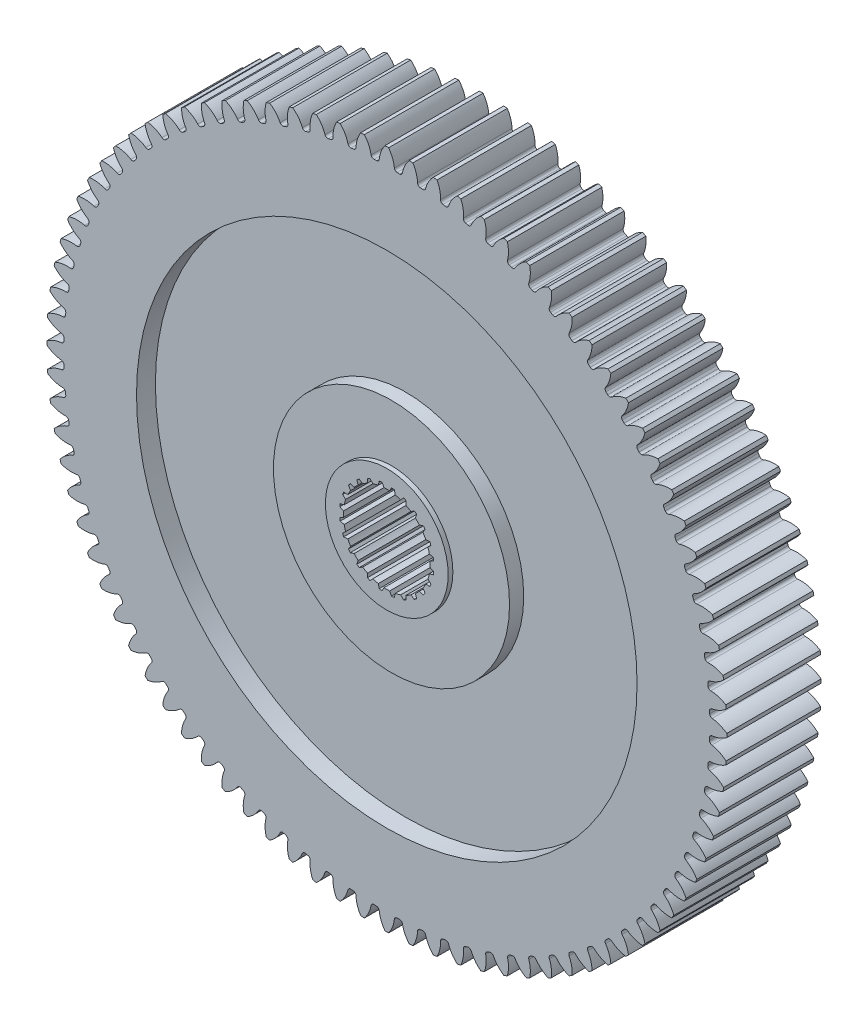
from build123d import *

# Parameters (mm, degrees)
ENL_V_MAT_EXTRU_1_DEPTH      = 52.15662225
R_P_TITION_CIRCULAIRE1_COUNT = 24
ENL_V_MAT_EXTRU_2_DEPTH      = 52.15662225
R_P_TITION_CIRCULAIRE2_COUNT = 88


with BuildPart() as part:
    # Esquisse1 → Révolution1 (revolve)
    with BuildSketch(Plane(origin=(0, 0, 0), x_dir=(0, 0, -1), z_dir=(1, 0, 0))):
        Polygon((-5, 4.6), (5, 4.6), (5, 6.5), (4.5, 6.5), (4.5, 12.5), (3, 12.5), (3, 26.5), (5, 26.5), (5, 36), (-5, 36), (-5, 26.5), (-3, 26.5), (-3, 12.5), (-4.5, 12.5), (-4.5, 6.5), (-5, 6.5), align=None)
    revolve(axis=Axis((0, 0, 15.512195122), (0, 0, -1)))

    # Esquisse2 → Enlèv. mat.-Extru.1 (cut, symmetric)
    with BuildSketch(Plane.XY):
        with BuildLine():
            Line((0.25, 4.493050189), (0.5, 4.974937186))
            ThreePointArc((0.5, 4.974937186), (0.652630961, 4.957224307), (0.804645579, 4.934829834))
            Line((0.804645579, 4.934829834), (0.921405503, 4.404657978))
            ThreePointArc((0.921405503, 4.404657978), (0.587367865, 4.461501876), (0.25, 4.493050189))
        make_face()
    enl_v_mat_extru_1 = extrude(amount=ENL_V_MAT_EXTRU_1_DEPTH, both=True, mode=Mode.SUBTRACT)

    # Répétition circulaire1: Enlèv. mat.-Extru.1 ×24 about axis
    r_p_tition_circulaire1_axis = Axis((0, 0, 0), (0, 0, 1))
    for i in range(1, R_P_TITION_CIRCULAIRE1_COUNT):
        add(enl_v_mat_extru_1.rotate(r_p_tition_circulaire1_axis, i * 360 / R_P_TITION_CIRCULAIRE1_COUNT), mode=Mode.SUBTRACT)

    # Esquisse3 → Enlèv. mat.-Extru.2 (cut, symmetric)
    with BuildSketch(Plane.XY):
        with BuildLine():
            ThreePointArc((1.350603123, 34.173321044), (1.220677817, 34.178208637), (1.090734869, 34.182602263))
            ThreePointArc((1.090734869, 34.182602263), (0.896560366, 34.262247349), (0.80209981, 34.449662077))
            ThreePointArc((0.80209981, 34.449662077), (0.601789765, 35.264614462), (0.196489878, 35.99946377))
            ThreePointArc((0.196489878, 35.99946377), (1.284924018, 35.977061724), (2.372183097, 35.92175869))
            ThreePointArc((2.372183097, 35.92175869), (1.915492317, 35.217695457), (1.657554603, 34.419109432))
            ThreePointArc((1.657554603, 34.419109432), (1.549964707, 34.238910954), (1.350603123, 34.173321044))
        make_face()
    enl_v_mat_extru_2 = extrude(amount=ENL_V_MAT_EXTRU_2_DEPTH, both=True, mode=Mode.SUBTRACT)

    # Répétition circulaire2: Enlèv. mat.-Extru.2 ×88 about axis
    r_p_tition_circulaire2_axis = Axis((0, 0, 0), (0, 0, 1))
    for i in range(1, R_P_TITION_CIRCULAIRE2_COUNT):
        add(enl_v_mat_extru_2.rotate(r_p_tition_circulaire2_axis, i * 360 / R_P_TITION_CIRCULAIRE2_COUNT), mode=Mode.SUBTRACT)


solid = part.part
